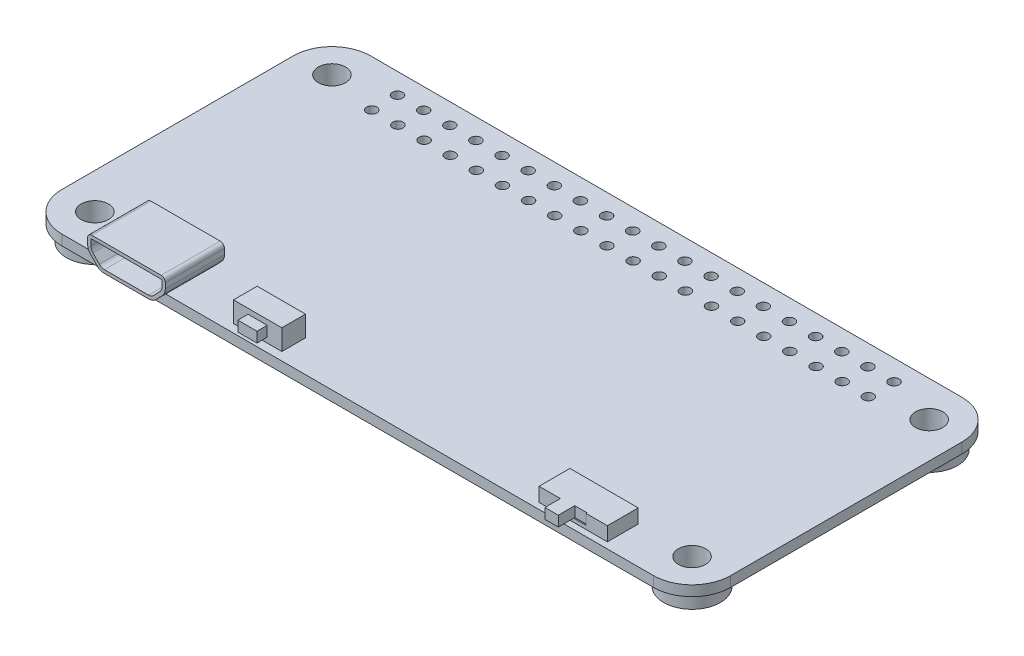
from build123d import *

# Parameters (mm, degrees)
BOSS_EXTRUDE1_DEPTH      = 1
SKETCH2_R                = 1.325
CUT_EXTRUDE1_DEPTH       = 36.80851854
SKETCH3_R                = 0.5
CUT_EXTRUDE2_DEPTH       = 36.80851854
LPATTERN1_COUNT          = 20
LPATTERN1_PITCH          = 2.54
BOSS_EXTRUDE6_DEPTH      = 1.25
BOSS_EXTRUDE6_DEPTH_BACK = 4.5
CUT_EXTRUDE9_DEPTH       = 5.25
SKETCH_1_W               = 4.7
SKETCH_1_H               = 2.3
EXTRUDE_1_DEPTH          = 2
SKETCH_2_W               = 1.86
SKETCH_2_H               = 1
EXTRUDE_2_DEPTH          = 1
SKETCH_6_W               = 6.64
SKETCH_6_H               = 3
EXTRUDE_6_DEPTH          = 1.36
SKETCH_7_W               = 2.5
SKETCH_7_H               = 1
CUT_EXTRUDE_1_DEPTH      = 0.1
SKETCH_8_W               = 1.3
SKETCH_8_H               = 1
EXTRUDE_7_DEPTH          = 1.6
SKETCH_9_R               = 2.75
SKETCH_9_R_2             = 1.325
EXTRUDE_8_DEPTH          = 1.5


with BuildPart() as part:
    # Sketch1 → Boss-Extrude1 (new body)
    with BuildSketch(Plane(origin=(0, 0, 0), x_dir=(1, 0, 0), z_dir=(0, 1, 0))):
        with BuildLine():
            Line((-28.75, 15), (28.75, 15))
            ThreePointArc((28.75, 15), (31.401650429, 13.901650429), (32.5, 11.25))
            Line((32.5, 11.25), (32.5, -11.25))
            ThreePointArc((32.5, -11.25), (31.401650429, -13.901650429), (28.75, -15))
            Line((28.75, -15), (-28.75, -15))
            ThreePointArc((-28.75, -15), (-31.401650429, -13.901650429), (-32.5, -11.25))
            Line((-32.5, -11.25), (-32.5, 11.25))
            ThreePointArc((-32.5, 11.25), (-31.401650429, 13.901650429), (-28.75, 15))
        make_face()
    extrude(amount=BOSS_EXTRUDE1_DEPTH)

    # Sketch2 → Cut-Extrude1 (cut, through all)
    with BuildSketch(Plane(origin=(0, 1, 0), x_dir=(1, 0, 0), z_dir=(0, 1, 0))):
        with Locations((-29.025, 11.525)):
            Circle(SKETCH2_R)
        with Locations((29.025, 11.525)):
            Circle(SKETCH2_R)
        with Locations((29.025, -11.525)):
            Circle(SKETCH2_R)
        with Locations((-29.025, -11.525)):
            Circle(SKETCH2_R)
    extrude(amount=-CUT_EXTRUDE1_DEPTH, mode=Mode.SUBTRACT)

    # Sketch3 → Cut-Extrude2 (cut, through all)
    with BuildSketch(Plane(origin=(0, 1, 0), x_dir=(1, 0, 0), z_dir=(0, 1, 0))):
        with Locations((-24.128, 13)):
            Circle(SKETCH3_R)
        with Locations((-24.128, 10.5)):
            Circle(SKETCH3_R)
    cut_extrude2 = extrude(amount=-CUT_EXTRUDE2_DEPTH, mode=Mode.SUBTRACT)

    # LPattern1: Cut-Extrude2 ×20
    with Locations(*[(i * LPATTERN1_PITCH, 0, 0) for i in range(1, LPATTERN1_COUNT)]):
        add(cut_extrude2, mode=Mode.SUBTRACT)

    # Sketch15 → Boss-Extrude6 (add, two sides: drawn at the far end of the back side and taken through both)
    with BuildSketch(Plane.XY.offset(15).offset(-BOSS_EXTRUDE6_DEPTH_BACK)):
        with BuildLine():
            Line((-24.6, 3.6), (-17.85, 3.6))
            ThreePointArc((-17.85, 3.6), (-17.567157288, 3.482842712), (-17.45, 3.2))
            Line((-17.45, 3.2), (-17.45, 2.652310288))
            ThreePointArc((-17.45, 2.652310288), (-17.522264229, 2.279072643), (-17.728612679, 1.959778459))
            Line((-17.728612679, 1.959778459), (-18.354830555, 1.307468172))
            ThreePointArc((-18.354830555, 1.307468172), (-18.684128491, 1.080072876), (-19.076217876, 1))
            Line((-19.076217876, 1), (-23.373782124, 1))
            ThreePointArc((-23.373782124, 1), (-23.765871509, 1.080072876), (-24.095169445, 1.307468172))
            Line((-24.095169445, 1.307468172), (-24.721387321, 1.959778459))
            ThreePointArc((-24.721387321, 1.959778459), (-24.927735771, 2.279072643), (-25, 2.652310288))
            Line((-25, 2.652310288), (-25, 3.2))
            ThreePointArc((-25, 3.2), (-24.882842712, 3.482842712), (-24.6, 3.6))
        make_face()
    extrude(amount=BOSS_EXTRUDE6_DEPTH + BOSS_EXTRUDE6_DEPTH_BACK)

    # Sketch16 → Cut-Extrude9 (cut)
    with BuildSketch(Plane.XY.offset(16.25)):
        with BuildLine():
            Line((-18.585674498, 1.529078357), (-17.959456622, 2.181388644))
            ThreePointArc((-17.959456622, 2.181388644), (-17.819139676, 2.398508689), (-17.77, 2.652310288))
            Line((-17.77, 2.652310288), (-17.77, 3.2))
            ThreePointArc((-17.77, 3.2), (-17.793431458, 3.256568542), (-17.85, 3.28))
            Line((-17.85, 3.28), (-24.6, 3.28))
            ThreePointArc((-24.6, 3.28), (-24.656568542, 3.256568542), (-24.68, 3.2))
            Line((-24.68, 3.2), (-24.68, 2.652310288))
            ThreePointArc((-24.68, 2.652310288), (-24.630860324, 2.398508689), (-24.490543378, 2.181388644))
            Line((-24.490543378, 2.181388644), (-23.864325502, 1.529078357))
            ThreePointArc((-23.864325502, 1.529078357), (-23.640402906, 1.374449555), (-23.373782124, 1.32))
            Line((-23.373782124, 1.32), (-19.076217876, 1.32))
            ThreePointArc((-19.076217876, 1.32), (-18.809597094, 1.374449555), (-18.585674498, 1.529078357))
        make_face()
    extrude(amount=-CUT_EXTRUDE9_DEPTH, mode=Mode.SUBTRACT)

    # 草图1 → 凸台-拉伸1 (add)
    with BuildSketch(Plane(origin=(0, 1, 0), x_dir=(1, 0, 0), z_dir=(0, 1, 0))):
        with Locations((-10.52, -13.05)):
            Rectangle(SKETCH_1_W, SKETCH_1_H)
    extrude(amount=EXTRUDE_1_DEPTH)

    # 草图2 → 凸台-拉伸2 (add)
    with BuildSketch(Plane.XY.offset(14.2)):
        with Locations((-10.52, 2)):
            Rectangle(SKETCH_2_W, SKETCH_2_H)
    extrude(amount=EXTRUDE_2_DEPTH)

    # 草图6 → 凸台-拉伸6 (add)
    with BuildSketch(Plane(origin=(0, 1, 0), x_dir=(1, 0, 0), z_dir=(0, 1, 0))):
        with Locations((20.35, -12.9)):
            Rectangle(SKETCH_6_W, SKETCH_6_H)
    extrude(amount=EXTRUDE_6_DEPTH)

    # 草图7 → 切除-拉伸1 (cut)
    with BuildSketch(Plane.XY.offset(14.4)):
        with Locations((20.35, 1.86)):
            Rectangle(SKETCH_7_W, SKETCH_7_H)
    extrude(amount=-CUT_EXTRUDE_1_DEPTH, mode=Mode.SUBTRACT)

    # 草图8 → 凸台-拉伸7 (add)
    with BuildSketch(Plane.XY.offset(14.3)):
        with Locations((19.75, 1.86)):
            Rectangle(SKETCH_8_W, SKETCH_8_H)
    extrude(amount=EXTRUDE_7_DEPTH)

    # 草图9 → 凸台-拉伸8 (add)
    # profile 1 of 4: a face of its own
    with BuildSketch(Plane.XZ):
        with Locations((29.025, 11.525)):
            Circle(SKETCH_9_R)
        with Locations((29.025, 11.525)):
            Circle(SKETCH_9_R_2, mode=Mode.SUBTRACT)
    # profile 2 of 4: a face of its own
    with BuildSketch(Plane.XZ):
        with Locations((29.025, -11.525)):
            Circle(SKETCH_9_R)
        with Locations((29.025, -11.525)):
            Circle(SKETCH_9_R_2, mode=Mode.SUBTRACT)
    # profile 3 of 4: a face of its own
    with BuildSketch(Plane.XZ):
        with Locations((-29.025, 11.525)):
            Circle(SKETCH_9_R)
        with Locations((-29.025, 11.525)):
            Circle(SKETCH_9_R_2, mode=Mode.SUBTRACT)
    # profile 4 of 4: a face of its own
    with BuildSketch(Plane.XZ):
        with Locations((-29.025, -11.525)):
            Circle(SKETCH_9_R)
        with Locations((-29.025, -11.525)):
            Circle(SKETCH_9_R_2, mode=Mode.SUBTRACT)
    extrude(amount=EXTRUDE_8_DEPTH)


solid = part.part
